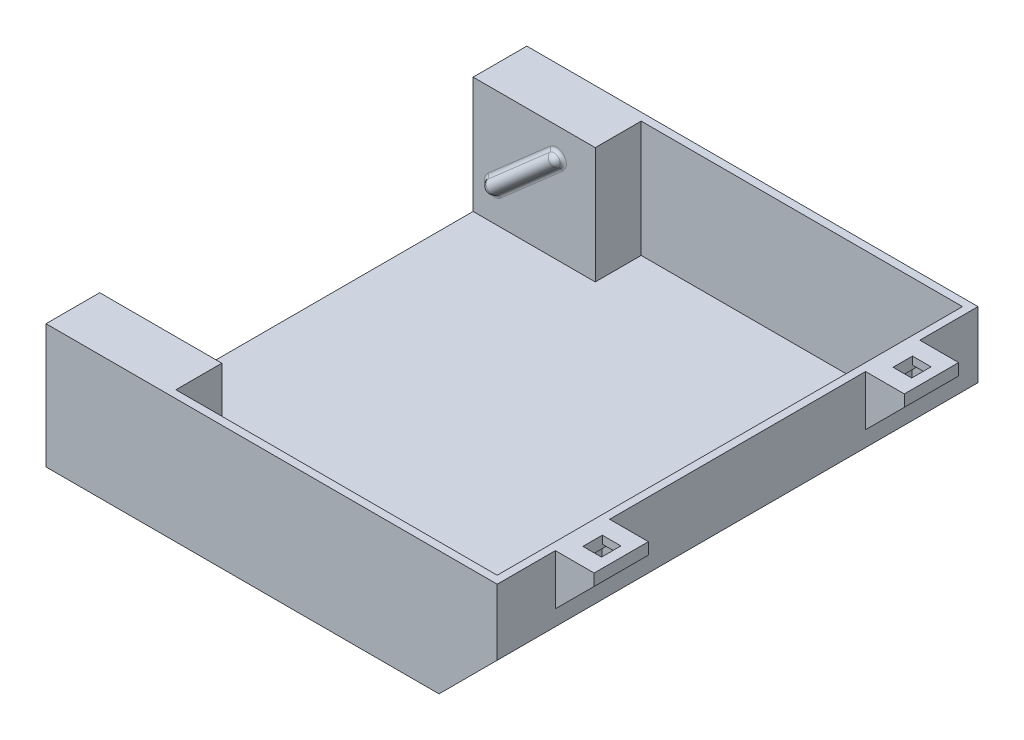
from build123d import *

# Parameters (mm, degrees)
BOSS_EXTRUDE1_DEPTH  = 30
SKETCH3_W            = 116.36
SKETCH3_H            = 124
BOSS_EXTRUDE2_DEPTH  = 2
REVOLVE1_ANGLE       = 358
FILLET1_R            = 1
CUT_EXTRUDE1_REACH   = 187.043
BOSS_EXTRUDE3_REACH  = 185.709
SKETCH9_R            = 2
SKETCH9_R_2          = 4
CUT_EXTRUDE3_DEPTH   = 1
SKETCH10_W           = 10
SKETCH10_H           = 10
SKETCH10_R           = 2.4
BOSS_EXTRUDE4_DEPTH  = 3
BOSS_EXTRUDE5_DEPTH  = 2
CUT_EXTRUDE4_DEPTH   = 1
SKETCH13_W           = 4.8
SKETCH13_H           = 5
CUT_EXTRUDE5_DEPTH   = 2
MIRROR4_COPY_1_DEPTH = 2
CUT_EXTRUDE6_START   = -0.5
CUT_EXTRUDE6_DEPTH   = 0.5


# Read off the part's stored shape, not the designer's step: Cut-Extrude6
with BuildPart() as part:
    # Sketch2 → Boss-Extrude1 (new body)
    with BuildSketch(Plane.XZ.offset(30)):
        Polygon((-102.07, -96.15), (-133.57, -96.15), (-133.57, -110), (-17.21, -110), (-17.21, 14), (-133.57, 14), (-133.57, 0.15), (-102.07, 0.15), (-102.07, 12), (-19.21, 12), (-19.21, 0.15), (-19.21, -96.15), (-19.21, -108), (-102.07, -108), align=None)
    extrude(amount=-BOSS_EXTRUDE1_DEPTH)

    # Sketch3 → Boss-Extrude2 (add)
    with BuildSketch(Plane.XZ.offset(30)):
        with Locations((-75.39, -48)):
            Rectangle(SKETCH3_W, SKETCH3_H)
    extrude(amount=BOSS_EXTRUDE2_DEPTH)

    # Sketch4 → Revolve1 (revolve)
    with BuildSketch(Plane(origin=(0, 0, 0.15), x_dir=(-1, 0, 0), z_dir=(0, 0, -1))):
        with BuildLine():
            ThreePointArc((126.946389188, -22.830754007), (128.214647144, -23.261442668), (129.415983818, -22.669191741))
            Line((129.415983818, -22.669191741), (110.772864663, -6.315578448))
            ThreePointArc((110.772864663, -6.315578448), (110.342176002, -7.583836403), (110.934426929, -8.785173077))
            Line((110.934426929, -8.785173077), (126.946389188, -22.830754007))
        make_face()
    revolve1 = revolve(axis=Axis((-128.10040537, -21.515175559, 0.15), (0.7517591128712743, 0.6594378183081363, 0)), revolution_arc=REVOLVE1_ANGLE)

    # Mirror3: Revolve1 across plane
    add(revolve1.mirror(Plane(origin=(0, 0, -48), x_dir=(1, 0, 0), z_dir=(0, 0, -1))))

    # Fillet1
    fillet1_edges = [part.edges().sort_by_distance(p)[0] for p in [
        (-128.214647144, -23.261442668, 0.15),
        (-121.248440423, -13.176806647, 0.15),
        (-111.974201337, -5.72332752, 0.15),
        (-118.940408059, -15.807963542, 0.15),
        (-128.214647144, -23.261442668, -96.15),
        (-121.248440423, -13.176806647, -96.15),
        (-111.974201337, -5.72332752, -96.15),
        (-118.940408059, -15.807963542, -96.15),
    ]]
    fillet(fillet1_edges, radius=FILLET1_R)

    # Cut-Extrude1: up to this face of the body (flat: up to its plane)
    cut_extrude1_end = Plane(part.part.faces().sort_by_distance((-75.39, -16, 14))[0])
    # Sketch5 → Cut-Extrude1 (cut, up to the picked face)
    with BuildSketch(Plane(origin=(0, 0, -110), x_dir=(-1, 0, 0), z_dir=(0, 0, -1)), mode=Mode.PRIVATE) as cut_extrude1_sk1:
        Polygon((32.21, -32), (17.21, -17), (17.21, -32), align=None)
    cut_extrude1_tool1 = split(extrude(cut_extrude1_sk1.sketch, amount=-CUT_EXTRUDE1_REACH, mode=Mode.PRIVATE), bisect_by=cut_extrude1_end, keep=Keep.BOTH, mode=Mode.PRIVATE)
    add(cut_extrude1_tool1.solids().sort_by(Axis((-22.21, -27, -110), (0, 0, 1)))[0], mode=Mode.SUBTRACT)

    # Sketch7 → Boss-Extrude3 (add, up to next)
    with BuildSketch(Plane(origin=(0, 0, 12), x_dir=(-1, 0, 0), z_dir=(0, 0, -1)), mode=Mode.PRIVATE) as boss_extrude3_sk1:
        Polygon((33.038427125, -30), (19.21, -16.171572875), (19.21, -19), (30.21, -30), align=None)
    boss_extrude3_tool1 = extrude(boss_extrude3_sk1.sketch, amount=BOSS_EXTRUDE3_REACH, mode=Mode.PRIVATE) - part.part
    add(boss_extrude3_tool1.solids().sort_by_distance((-25.443958, -23.766042, 12))[0])

    # Sketch9 → Cut-Extrude3 (cut)
    with BuildSketch(Plane(origin=(0, 0, -110), x_dir=(-1, 0, 0), z_dir=(0, 0, -1))):
        with Locations((111.05096655, -7)):
            Circle(SKETCH9_R)
        with Locations((111.05096655, -23)):
            Circle(SKETCH9_R_2)
        with Locations((111.05096655, -13)):
            Circle(SKETCH9_R)
        Polygon((127.147055737, -27), (121.090407141, -27), (122.676520454, -19.790973413), (116.946384418, -19.790973413), (122.811770426, -5), (122.811770426, -15.583196494), (127.147055737, -15.583196494), align=None)
        Polygon((113.010558344, -12.6), (114.970150138, -22.2), (107.131782961, -22.2), (109.091374756, -12.6), align=None)
    extrude(amount=-CUT_EXTRUDE3_DEPTH, mode=Mode.SUBTRACT)

    # Sketch10 → Boss-Extrude4 (add)
    with BuildSketch(Plane.XZ):
        with Locations((-12.21, -88)):
            Rectangle(SKETCH10_W, SKETCH10_H)
        with Locations((-12.21, -88)):
            Circle(SKETCH10_R, mode=Mode.SUBTRACT)
    boss_extrude4 = extrude(amount=BOSS_EXTRUDE4_DEPTH)

    # Sketch11 → Boss-Extrude5 (add)
    with BuildSketch(Plane(origin=(0, 0, -93), x_dir=(-1, 0, 0), z_dir=(0, 0, -1))):
        Polygon((7.21, -3), (17.21, -13), (17.21, 0), (7.21, 0), align=None)
    boss_extrude5 = extrude(amount=BOSS_EXTRUDE5_DEPTH)

    # Mirror5: Boss-Extrude5 across plane
    add(boss_extrude5.mirror(Plane.XY.offset(-88)))

    # Sketch12 → Cut-Extrude4 (cut)
    with BuildSketch(Plane.XZ.offset(3)):
        Polygon((-9.81, -88), (-9.81, -93), (-14.61, -93), (-14.61, -88), (-14.61, -83), (-9.81, -83), align=None)
    cut_extrude4 = extrude(amount=-CUT_EXTRUDE4_DEPTH, mode=Mode.SUBTRACT)

    # Sketch13 → Cut-Extrude5 (cut)
    with BuildSketch(Plane.XZ.offset(2)):
        with Locations((-12.21, -88)):
            Rectangle(SKETCH13_W, SKETCH13_H)
    cut_extrude5 = extrude(amount=-CUT_EXTRUDE5_DEPTH, mode=Mode.SUBTRACT)

    # Mirror4: Boss-Extrude4, Boss-Extrude5, Cut-Extrude4, Cut-Extrude5 across plane
    add(boss_extrude4.mirror(Plane.XY.offset(-48)))
    add(boss_extrude5.mirror(Plane.XY.offset(-48)))
    add(cut_extrude4.mirror(Plane.XY.offset(-48)), mode=Mode.SUBTRACT)
    add(cut_extrude5.mirror(Plane.XY.offset(-48)), mode=Mode.SUBTRACT)

    # Mirror4 copy 1 sketch → Mirror4 copy 1 (add)
    with BuildSketch(Plane(origin=(0, 0, -13), x_dir=(-1, 0, 0), z_dir=(0, 0, -1))):
        Polygon((7.21, -3), (17.21, -13), (17.21, 0), (7.21, 0), align=None)
    extrude(amount=MIRROR4_COPY_1_DEPTH)

    # Cut-Extrude6 outline → Cut-Extrude6 (cut)
    # profile 1 of 9: a face of its own
    with BuildSketch(Plane(origin=(-0.105, 0.105, 0), x_dir=(0, 0, -1), z_dir=(0.7071067811865476, -0.7071067811865476, 0)).offset(CUT_EXTRUDE6_START)):
        with BuildLine():
            add(Edge.make_bspline(
                [(7.474736048, -32.560187678), (7.481784989, -32.686737386), (7.495462968, -32.932298263), (7.554582597, -33.28662707), (7.642912572, -33.615333656), (7.761441798, -33.919784296), (7.913473714, -34.198728864), (8.095232248, -34.453133811), (8.308026903, -34.682350235), (8.553290569, -34.87969149), (8.816458503, -35.056906889), (9.09589014, -35.209228141), (9.388017477, -35.338190216), (9.692140765, -35.443177021), (10.008629383, -35.528095419), (10.338990287, -35.582377682), (10.681600511, -35.617811607), (10.914185968, -35.621856709), (11.032428356, -35.623913168)],
                knots=[0, 0, 0, 0, 0.071932954, 0.139580877, 0.203559558, 0.26492787, 0.324655415, 0.383483764, 0.44206478, 0.501651417, 0.561832516, 0.622044295, 0.682123722, 0.742958404, 0.804591799, 0.867957378, 0.932871835, 1, 1, 1, 1], degree=3))
            add(Edge.make_bspline(
                [(11.032428356, -35.623913168), (11.135629491, -35.62275178), (11.334964247, -35.62050854), (11.532796246, -35.596094582), (11.628205128, -35.584320408)],
                knots=[0, 0, 0, 0, 0.517727753, 1, 1, 1, 1], degree=3))
            Line((11.628205128, -35.584320408), (11.344989115, -37.580923061))
            Line((11.344989115, -37.580923061), (7.763667088, -37.580923061))
            Line((7.763667088, -37.580923061), (7.763667088, -39.134469396))
            Line((7.763667088, -39.134469396), (12.836290639, -39.134469396))
            Line((12.836290639, -39.134469396), (13.489622735, -34.149962936))
            add(Edge.make_bspline(
                [(13.489622735, -34.149962936), (13.400894652, -34.160062564), (13.215783257, -34.181133189), (12.924845872, -34.1975649), (12.610633708, -34.212455799), (12.393059012, -34.213247395), (12.280542986, -34.213656758)],
                knots=[0, 0, 0, 0, 0.221099217, 0.461274306, 0.721404763, 1, 1, 1, 1], degree=3))
            add(Edge.make_bspline(
                [(12.280542986, -34.213656758), (12.170527336, -34.212261595), (11.956535838, -34.209547862), (11.646156106, -34.187153046), (11.356173038, -34.148927873), (11.086718503, -34.099865663), (10.83824514, -34.032746726), (10.609618542, -33.955393141), (10.402088982, -33.860077802), (10.215256552, -33.751512139), (10.04967142, -33.628638903), (9.906689566, -33.491623503), (9.78559612, -33.341800701), (9.683999886, -33.180452089), (9.606098096, -33.005173519), (9.552204193, -32.816623148), (9.516946586, -32.616173424), (9.512966995, -32.478013034), (9.510935143, -32.407472746)],
                knots=[0, 0, 0, 0, 0.088558352, 0.172254896, 0.250318508, 0.323942698, 0.392542315, 0.457340998, 0.518010803, 0.576058968, 0.631001494, 0.683599686, 0.735036649, 0.785714141, 0.836671168, 0.888861455, 0.943256205, 1, 1, 1, 1], degree=3))
            add(Edge.make_bspline(
                [(9.510935143, -32.407472746), (9.515313327, -32.340092176), (9.523874534, -32.208334555), (9.558047701, -32.016719441), (9.610321639, -31.836800364), (9.682516846, -31.669929411), (9.772512083, -31.515015463), (9.879778981, -31.371118342), (10.007202979, -31.240773572), (10.150886344, -31.124215465), (10.307123124, -31.021657413), (10.471551796, -30.930643014), (10.643782582, -30.853355552), (10.823141424, -30.788590103), (11.010783213, -30.740048619), (11.204865407, -30.704661214), (11.40639609, -30.680655659), (11.543292456, -30.678038504), (11.613122172, -30.676703515)],
                knots=[0, 0, 0, 0, 0.066600926, 0.130233086, 0.191662727, 0.251116047, 0.309201236, 0.368124829, 0.427778404, 0.488613353, 0.550370905, 0.612000623, 0.673907498, 0.73649114, 0.799978035, 0.864941462, 0.931107746, 1, 1, 1, 1], degree=3))
            add(Edge.make_bspline(
                [(11.613122172, -30.676703515), (11.716250548, -30.679987282), (11.918464833, -30.686426096), (12.216308989, -30.714959959), (12.502146395, -30.759798276), (12.774192762, -30.82058749), (13.027431068, -30.889568027), (13.257854782, -30.962621869), (13.462038342, -31.038968646), (13.586770856, -31.096448809), (13.645550528, -31.123536094)],
                knots=[0, 0, 0, 0, 0.147651019, 0.289514355, 0.427930962, 0.561495696, 0.688273037, 0.803481788, 0.90739162, 1, 1, 1, 1], degree=3))
            Line((13.645550528, -31.123536094), (14.057737601, -29.660489337))
            add(Edge.make_bspline(
                [(14.057737601, -29.660489337), (13.984891363, -29.626741054), (13.830649427, -29.555283685), (13.576268882, -29.464667197), (13.290055088, -29.37828999), (12.973798652, -29.299667146), (12.632191287, -29.234035082), (12.270330255, -29.185219838), (11.890758767, -29.155140273), (11.632029264, -29.148944929), (11.5, -29.145783455)],
                knots=[0, 0, 0, 0, 0.091590522, 0.19393039, 0.307840036, 0.432747493, 0.56568423, 0.704658722, 0.849287804, 1, 1, 1, 1], degree=3))
            add(Edge.make_bspline(
                [(11.5, -29.145783455), (11.345844829, -29.15153033), (11.046031649, -29.162707307), (10.610143875, -29.219325541), (10.200327509, -29.300016773), (9.817038045, -29.414266075), (9.459404205, -29.555150988), (9.127064531, -29.72510467), (8.821461518, -29.925841576), (8.545394197, -30.15574495), (8.299356658, -30.407008708), (8.080187776, -30.670738731), (7.896442293, -30.95107944), (7.746831944, -31.24622055), (7.626736478, -31.553967937), (7.542500434, -31.877339731), (7.488232083, -32.214004345), (7.479276688, -32.443716899), (7.474736048, -32.560187678)],
                knots=[0, 0, 0, 0, 0.078431806, 0.152540384, 0.223322642, 0.290686454, 0.355689299, 0.418598088, 0.480220108, 0.54128905, 0.600967427, 0.658886016, 0.715454944, 0.771070096, 0.826934595, 0.883151957, 0.940754729, 1, 1, 1, 1], degree=3))
        make_face()
    # profile 2 of 9: a face of its own
    with BuildSketch(Plane(origin=(-0.105, 0.105, 0), x_dir=(0, 0, -1), z_dir=(0.7071067811865476, -0.7071067811865476, 0)).offset(CUT_EXTRUDE6_START)):
        with BuildLine():
            add(Edge.make_bspline(
                [(17.325414781, -31.642012716), (17.413829101, -31.636329218), (17.584419352, -31.625363241), (17.827769919, -31.558201975), (18.044701278, -31.447215565), (18.232046001, -31.295100607), (18.386307437, -31.109674091), (18.498440558, -30.894274392), (18.571205655, -30.653587783), (18.581435261, -30.483677443), (18.586726998, -30.395783455)],
                knots=[0, 0, 0, 0, 0.134054034, 0.258649407, 0.379667062, 0.50093949, 0.622077105, 0.742689012, 0.866893981, 1, 1, 1, 1], degree=3))
            add(Edge.make_bspline(
                [(18.586726998, -30.395783455), (18.581987108, -30.306671883), (18.572869761, -30.135262616), (18.503828305, -29.892592523), (18.398241486, -29.674188592), (18.247214563, -29.487488142), (18.063255594, -29.332187317), (17.844633555, -29.218874018), (17.594873712, -29.150596367), (17.418175706, -29.140002166), (17.32626261, -29.134521789)],
                knots=[0, 0, 0, 0, 0.133513631, 0.256818201, 0.375732821, 0.495158488, 0.614315849, 0.734513257, 0.861704257, 0.999576079, 0.999576079, 0.999576079, 0.999576079], degree=3))
            add(Edge.make_bspline(
                [(17.32626261, -29.134521789), (17.234425797, -29.139347744), (17.057929662, -29.148691624), (16.808675223, -29.215362376), (16.589607409, -29.324951497), (16.404422539, -29.474654689), (16.2543648, -29.657951113), (16.148073287, -29.872714574), (16.080164102, -30.113979401), (16.070826091, -30.284704104), (16.065987934, -30.37315902)],
                knots=[0.000501848, 0.000501848, 0.000501848, 0.000501848, 0.139177534, 0.267028384, 0.387218501, 0.506757808, 0.624223306, 0.742289949, 0.866476729, 1, 1, 1, 1], degree=3))
            add(Edge.make_bspline(
                [(16.065987934, -30.37315902), (16.071339616, -30.466030537), (16.081580076, -30.643740451), (16.151606608, -30.894645464), (16.261076326, -31.115928587), (16.414608427, -31.303124792), (16.602617706, -31.45281703), (16.819951383, -31.562445967), (17.064771384, -31.62710806), (17.23641214, -31.636923181), (17.325414781, -31.642012716)],
                knots=[0, 0, 0, 0, 0.138763142, 0.26552367, 0.386557335, 0.50543776, 0.624459236, 0.743391647, 0.866938239, 1, 1, 1, 1], degree=3))
        make_face()
    # profile 3 of 9: a face of its own
    with BuildSketch(Plane(origin=(-0.105, 0.105, 0), x_dir=(0, 0, -1), z_dir=(0.7071067811865476, -0.7071067811865476, 0)).offset(CUT_EXTRUDE6_START)):
        with BuildLine():
            add(Edge.make_bspline(
                [(24.990950226, -37.703475763), (24.920487201, -37.700733487), (24.783556023, -37.695404407), (24.586266218, -37.670783868), (24.402867201, -37.633956371), (24.235552741, -37.580351174), (24.080659318, -37.517541578), (23.942303354, -37.436780405), (23.816821684, -37.345414774), (23.708734859, -37.2378875), (23.615399619, -37.121164759), (23.533654948, -36.998258961), (23.464900395, -36.86812815), (23.408649445, -36.731143737), (23.365165226, -36.58717967), (23.33483741, -36.436971036), (23.318048809, -36.279783766), (23.315935471, -36.172594857), (23.314856712, -36.117879986)],
                knots=[0, 0, 0, 0, 0.080836785, 0.157090562, 0.227765582, 0.295009514, 0.358322524, 0.419021825, 0.478266002, 0.535856279, 0.593261355, 0.649431573, 0.70488515, 0.761767545, 0.818995899, 0.877089079, 0.937259784, 1, 1, 1, 1], degree=3))
            add(Edge.make_bspline(
                [(23.314856712, -36.117879986), (23.317829231, -36.035338964), (23.323836436, -35.868530707), (23.371194856, -35.619196266), (23.436057693, -35.365441297), (23.531681623, -35.110651798), (23.650915544, -34.851603509), (23.799626653, -34.593191255), (23.969298649, -34.328540841), (24.169731862, -34.064027501), (24.391281869, -33.789999776), (24.63412328, -33.505959086), (24.899566672, -33.211827739), (25.183715078, -32.903967068), (25.49147498, -32.585644224), (25.82088975, -32.256345772), (26.172765374, -31.916227876), (26.416008706, -31.687593613), (26.540723982, -31.570368674)],
                knots=[0, 0, 0, 0, 0.043348568, 0.087603702, 0.133027855, 0.180886833, 0.230391752, 0.282748674, 0.337442309, 0.395507591, 0.457046171, 0.522641756, 0.59187352, 0.6652618, 0.74281311, 0.824555661, 0.9100465, 1, 1, 1, 1], degree=3))
            Line((26.540723982, -31.570368674), (27.733833324, -30.404510654))
            Line((27.733833324, -30.404510654), (27.733833324, -29.255134888))
            Line((27.733833324, -29.255134888), (21.08169726, -29.255134888))
            Line((21.08169726, -29.255134888), (21.08169726, -30.808679382))
            Line((21.08169726, -30.808679382), (24.964273352, -30.808679382))
            Line((24.964273352, -30.808679382), (24.964273352, -30.83489412))
            Line((24.964273352, -30.83489412), (24.069492438, -31.647550989))
            add(Edge.make_bspline(
                [(24.069492438, -31.647550989), (23.878224764, -31.827237786), (23.503849898, -32.178945), (22.985119031, -32.7305918), (22.516684291, -33.287912323), (22.160214399, -33.759079478), (21.910265886, -34.142885683), (21.748812575, -34.435173325), (21.611718524, -34.732908474), (21.49543149, -35.035375189), (21.404568834, -35.343681461), (21.339189242, -35.657780262), (21.294428204, -35.977185523), (21.283932777, -36.19252697), (21.278657617, -36.30076083)],
                knots=[0, 0, 0, 0, 0.141044372, 0.276071053, 0.406742324, 0.532278129, 0.593374672, 0.652797979, 0.71159574, 0.769442499, 0.826845633, 0.884157239, 0.94177568, 1, 1, 1, 1], degree=3))
            add(Edge.make_bspline(
                [(21.278657617, -36.30076083), (21.280671289, -36.402042019), (21.284636746, -36.601491632), (21.320708956, -36.89455051), (21.383054065, -37.174766906), (21.470455265, -37.442354119), (21.581362312, -37.69824925), (21.720075878, -37.94037796), (21.883777633, -38.169566692), (22.069652178, -38.386885246), (22.282634443, -38.58727901), (22.52858619, -38.757936477), (22.79982787, -38.906660225), (23.09986043, -39.026051509), (23.426721475, -39.122774805), (23.781483585, -39.192637089), (24.163900006, -39.241107835), (24.428327109, -39.250358542), (24.564856712, -39.255134888)],
                knots=[0, 0, 0, 0, 0.060806115, 0.119743423, 0.176972643, 0.232948626, 0.288553122, 0.344166583, 0.400193438, 0.457463712, 0.515681236, 0.575262739, 0.636739813, 0.701077851, 0.768786907, 0.841175994, 0.917995628, 1, 1, 1, 1], degree=3))
            add(Edge.make_bspline(
                [(24.564856712, -39.255134888), (24.717740298, -39.250672171), (25.01874365, -39.241885794), (25.458981488, -39.187002252), (25.881177531, -39.107395831), (26.279656833, -38.994437131), (26.650765064, -38.857581298), (26.993188394, -38.712899664), (27.300443002, -38.551251516), (27.486199093, -38.428308395), (27.575791855, -38.369011207)],
                knots=[0, 0, 0, 0, 0.14407048, 0.283651753, 0.417580824, 0.548645251, 0.673428707, 0.790161205, 0.898791813, 1, 1, 1, 1], degree=3))
            Line((27.575791855, -38.369011207), (26.995283999, -36.98225011))
            add(Edge.make_bspline(
                [(26.995283999, -36.98225011), (26.929676395, -37.026631906), (26.79522823, -37.117582508), (26.579796707, -37.244332673), (26.345604364, -37.361173771), (26.099252725, -37.475718858), (25.837772924, -37.572560335), (25.564404288, -37.643670553), (25.280962926, -37.690678398), (25.088543033, -37.699169293), (24.990950226, -37.703475763)],
                knots=[0, 0, 0, 0, 0.10991459, 0.225245463, 0.346555609, 0.473020633, 0.602158273, 0.732897114, 0.864528974, 1, 1, 1, 1], degree=3))
        make_face()
    # profile 4 of 9: a face of its own
    with BuildSketch(Plane(origin=(-0.105, 0.105, 0), x_dir=(0, 0, -1), z_dir=(0.7071067811865476, -0.7071067811865476, 0)).offset(CUT_EXTRUDE6_START)):
        with BuildLine():
            Line((46.144217513, -39.255133047), (48.487691336, -35.874302762))
            add(Edge.make_bspline(
                [(48.487691336, -35.874302762), (48.603369845, -35.685388383), (48.836400114, -35.304827041), (49.066835728, -34.922688988), (49.182880845, -34.73024801)],
                knots=[0, 0, 0, 0, 0.496409799, 1, 1, 1, 1], degree=3))
            Line((49.182880845, -34.73024801), (49.226240662, -34.729927644))
            Line((49.226240662, -34.729927644), (49.226240662, -39.255133047))
            Line((49.226240662, -39.255133047), (51.262443439, -39.255133047))
            Line((51.262443439, -39.255133047), (51.262443439, -29.255133047))
            Line((51.262443439, -29.255133047), (49.226240662, -29.255133047))
            Line((49.226240662, -29.255133047), (49.226240662, -32.675254137))
            Line((49.226240662, -32.675254137), (48.416676977, -33.676582365))
            Line((48.416676977, -33.676582365), (45.888565823, -29.255133047))
            Line((45.888565823, -29.255133047), (43.488280514, -29.255133047))
            Line((43.488280514, -29.255133047), (46.939578325, -34.977008636))
            Line((46.939578325, -34.977008636), (43.644512102, -39.255133047))
            Line((43.644512102, -39.255133047), (46.144217513, -39.255133047))
        make_face()
    # profile 5 of 9: a face of its own
    with BuildSketch(Plane(origin=(-0.105, 0.105, 0), x_dir=(0, 0, -1), z_dir=(0.7071067811865476, -0.7071067811865476, 0)).offset(CUT_EXTRUDE6_START)):
        with BuildLine():
            add(Edge.make_bspline(
                [(82.578808446, -38.738543636), (82.672007013, -38.795184967), (82.861417719, -38.910299127), (83.170291127, -39.0486174), (83.502023907, -39.159818239), (83.858168478, -39.244249801), (84.240873852, -39.305308192), (84.653817945, -39.347453185), (85.097910224, -39.375122322), (85.404933074, -39.375568383), (85.563348416, -39.375798538)],
                knots=[0, 0, 0, 0, 0.105621395, 0.214658056, 0.327146471, 0.444300722, 0.56897106, 0.702493007, 0.846494578, 1, 1, 1, 1], degree=3))
            add(Edge.make_bspline(
                [(85.563348416, -39.375798538), (85.824836179, -39.372820172), (86.333731392, -39.367023817), (86.95743495, -39.331341789), (87.42377458, -39.286650144), (87.738393985, -39.254379544), (88.021356873, -39.215170947), (88.19855326, -39.183385667), (88.282051282, -39.168407889)],
                knots=[0, 0, 0, 0, 0.287357548, 0.559241776, 0.686172265, 0.802176441, 0.906782095, 1, 1, 1, 1], degree=3))
            Line((88.282051282, -39.168407889), (88.282051282, -29.26355645))
            add(Edge.make_bspline(
                [(88.282051282, -29.26355645), (88.215460788, -29.254886448), (88.07426793, -29.236503306), (87.849973682, -29.211790353), (87.601002601, -29.191347718), (87.327503335, -29.17520837), (87.02965212, -29.159429845), (86.706541529, -29.149147754), (86.359025786, -29.138946657), (86.118911611, -29.135993841), (85.995098039, -29.134471238)],
                knots=[0, 0, 0, 0, 0.087893802, 0.186362593, 0.295318855, 0.414821763, 0.544955105, 0.685701991, 0.837933936, 1, 1, 1, 1], degree=3))
            add(Edge.make_bspline(
                [(85.995098039, -29.134471238), (85.873168667, -29.135163139), (85.634911485, -29.136515154), (85.286013279, -29.147977656), (84.953459675, -29.166711399), (84.637154807, -29.192538488), (84.337443827, -29.227233122), (84.054010802, -29.265022248), (83.787814983, -29.315440507), (83.536564749, -29.369172914), (83.300496628, -29.431059665), (83.079000921, -29.501977377), (82.869952262, -29.575902382), (82.674833055, -29.65921045), (82.493957839, -29.750026186), (82.325462188, -29.845306156), (82.171247358, -29.949727898), (82.07678872, -30.026208963), (82.030165913, -30.063958417)],
                knots=[0, 0, 0, 0, 0.088179237, 0.172307428, 0.252429853, 0.329051868, 0.401780249, 0.470621333, 0.535787383, 0.597657258, 0.656417251, 0.712190401, 0.765816567, 0.816723492, 0.865506409, 0.912128385, 0.956628409, 1, 1, 1, 1], degree=3))
            add(Edge.make_bspline(
                [(82.030165913, -30.063958417), (81.954438226, -30.130845889), (81.804872852, -30.262951467), (81.609446455, -30.487874426), (81.443665479, -30.7304807), (81.303186171, -30.986944688), (81.193534727, -31.256472599), (81.117568561, -31.535231571), (81.065000234, -31.820427508), (81.058640837, -32.013821609), (81.055429864, -32.111469729)],
                knots=[0, 0, 0, 0, 0.12935453, 0.255480651, 0.380561371, 0.505237079, 0.629498629, 0.752388038, 0.874976318, 1, 1, 1, 1], degree=3))
            add(Edge.make_bspline(
                [(81.055429864, -32.111469729), (81.058308369, -32.190160334), (81.063950702, -32.344406579), (81.098048938, -32.569130091), (81.143640352, -32.784224495), (81.210856804, -32.988232057), (81.292713479, -33.183666022), (81.396524092, -33.366439759), (81.512533138, -33.541830442), (81.649409407, -33.702782628), (81.798492135, -33.853641732), (81.958645958, -33.993696975), (82.1306467, -34.119696288), (82.3124453, -34.233733144), (82.505006143, -34.333428024), (82.708198038, -34.420048424), (82.921241846, -34.496657435), (83.069292709, -34.535299965), (83.144419306, -34.554908643)],
                knots=[0, 0, 0, 0, 0.067786574, 0.132872589, 0.195535261, 0.257005284, 0.317649459, 0.377759528, 0.437828128, 0.498556841, 0.559432613, 0.620452685, 0.681638284, 0.742933984, 0.805171819, 0.868233227, 0.933136565, 1, 1, 1, 1], degree=3))
            Line((83.144419306, -34.554908643), (83.14459606, -34.605863333))
            add(Edge.make_bspline(
                [(83.14459606, -34.605863333), (83.081383603, -34.633457039), (82.956595139, -34.687930104), (82.777936376, -34.779787711), (82.611417233, -34.880461813), (82.454982433, -34.987557057), (82.312595373, -35.107076038), (82.179897935, -35.232731462), (82.060366414, -35.368438196), (81.916225714, -35.556383689), (81.767331033, -35.808723966), (81.635107818, -36.129475758), (81.55552073, -36.468524102), (81.543948058, -36.700045684), (81.538084465, -36.817352082)],
                knots=[0, 0, 0, 0, 0.071150577, 0.140459203, 0.207067473, 0.271819458, 0.335826993, 0.398654504, 0.460200893, 0.5221897, 0.642841851, 0.761202057, 0.879006845, 1, 1, 1, 1], degree=3))
            add(Edge.make_bspline(
                [(81.538084465, -36.817352082), (81.541537606, -36.920708674), (81.548284207, -37.122642385), (81.606017161, -37.415378948), (81.690792349, -37.690766311), (81.813913572, -37.945107361), (81.963863226, -38.179549055), (82.144185522, -38.389444311), (82.345456175, -38.582220861), (82.500433579, -38.686040283), (82.578808446, -38.738543636)],
                knots=[0, 0, 0, 0, 0.135682219, 0.265090147, 0.390711737, 0.513341876, 0.635202187, 0.755318023, 0.876259913, 1, 1, 1, 1], degree=3))
        make_face()
        with BuildLine():
            Line((86.245848505, -35.141256727), (86.245848505, -37.876007328))
            add(Edge.make_bspline(
                [(86.245848505, -37.876007328), (86.193823937, -37.886621779), (86.074294767, -37.911009038), (85.867842758, -37.928737617), (85.611860731, -37.938976891), (85.424477835, -37.941524641), (85.322021116, -37.942917693)],
                knots=[0, 0, 0, 0, 0.171556976, 0.394161141, 0.668741048, 1, 1, 1, 1], degree=3))
            add(Edge.make_bspline(
                [(85.322021116, -37.942917693), (85.205566001, -37.940780271), (84.981378019, -37.936665515), (84.657259556, -37.883759228), (84.362243146, -37.789110067), (84.136772888, -37.680012916), (83.977667426, -37.568675111), (83.873488165, -37.470738568), (83.785739772, -37.356850134), (83.712058976, -37.231046274), (83.655089001, -37.089801255), (83.612301114, -36.93552999), (83.583708916, -36.766791403), (83.577492007, -36.649667927), (83.57428356, -36.589222369)],
                knots=[0, 0, 0, 0, 0.139073938, 0.267731525, 0.390766118, 0.508323901, 0.565423395, 0.622270422, 0.678458735, 0.73668321, 0.795959022, 0.85992178, 0.927707864, 1, 1, 1, 1], degree=3))
            add(Edge.make_bspline(
                [(83.57428356, -36.589222369), (83.576398095, -36.536986221), (83.580573734, -36.433833861), (83.604483461, -36.282862598), (83.647491332, -36.140740517), (83.701167269, -36.004845572), (83.774507073, -35.879068018), (83.858611342, -35.758231401), (83.963013147, -35.64920581), (84.078454768, -35.545400343), (84.209643802, -35.452877323), (84.35375391, -35.371714473), (84.510176784, -35.301882082), (84.679645415, -35.24571149), (84.860998353, -35.199971812), (85.056015601, -35.169059215), (85.263137506, -35.147943137), (85.405552713, -35.143522895), (85.478506787, -35.141258568)],
                knots=[0, 0, 0, 0, 0.058458899, 0.115440621, 0.17039104, 0.224310862, 0.278463936, 0.332894685, 0.388608868, 0.446877215, 0.506375316, 0.56776648, 0.631655081, 0.697685622, 0.767255564, 0.840649359, 0.918370526, 1, 1, 1, 1], degree=3))
            Line((85.478506787, -35.141258568), (86.245848505, -35.141256727))
        make_face(mode=Mode.SUBTRACT)
        with BuildLine():
            Line((86.245848505, -33.731000317), (85.464791829, -33.731000317))
            add(Edge.make_bspline(
                [(85.464791829, -33.731000317), (85.320746983, -33.729228357), (85.040867008, -33.72578543), (84.636139522, -33.656357229), (84.257951851, -33.548497989), (83.966615688, -33.416745338), (83.754932265, -33.287435454), (83.616951706, -33.17267036), (83.499481391, -33.041421726), (83.400757478, -32.895708175), (83.322555902, -32.734341631), (83.263927615, -32.557645526), (83.226691431, -32.364886437), (83.217174209, -32.231031804), (83.212292609, -32.162374707)],
                knots=[0, 0, 0, 0, 0.139950818, 0.271925253, 0.398069207, 0.521735166, 0.581617957, 0.638920115, 0.695635418, 0.752442919, 0.80959157, 0.869527398, 0.933077624, 1, 1, 1, 1], degree=3))
            add(Edge.make_bspline(
                [(83.212292609, -32.162374707), (83.215617062, -32.094932444), (83.222095261, -31.963510994), (83.259997667, -31.774336315), (83.310686829, -31.598120041), (83.384285665, -31.438039936), (83.47280954, -31.290255752), (83.58322826, -31.158650119), (83.710555654, -31.039870272), (83.856839644, -30.939410339), (84.015764431, -30.850812279), (84.184738287, -30.774889749), (84.361630233, -30.707132134), (84.547951263, -30.65508158), (84.744183484, -30.616142968), (84.947906977, -30.585595368), (85.161455439, -30.568151884), (85.306278363, -30.567623011), (85.380467572, -30.567352082)],
                knots=[0, 0, 0, 0, 0.066731024, 0.130035493, 0.190438485, 0.247776546, 0.303880358, 0.360416829, 0.417188833, 0.475678945, 0.535541637, 0.597048725, 0.658847533, 0.72283265, 0.788208097, 0.856723657, 0.926603067, 1, 1, 1, 1], degree=3))
            add(Edge.make_bspline(
                [(85.380467572, -30.567352082), (85.467837248, -30.567329774), (85.631953488, -30.56728787), (85.86334883, -30.576950127), (86.064329556, -30.591901742), (86.18749189, -30.611264033), (86.243966817, -30.620142429)],
                knots=[0, 0, 0, 0, 0.302564613, 0.568340975, 0.802066825, 1, 1, 1, 1], degree=3))
            Line((86.243966817, -30.620142429), (86.245848505, -33.731000317))
        make_face(mode=Mode.SUBTRACT)
    # profile 6 of 9: a face of its own
    with BuildSketch(Plane(origin=(-0.105, 0.105, 0), x_dir=(0, 0, -1), z_dir=(0.7071067811865476, -0.7071067811865476, 0)).offset(CUT_EXTRUDE6_START)):
        Polygon((53.812282741, -29.255134888), (53.812282741, -30.808679382), (57.817492547, -30.808679382), (57.817492547, -33.719688099), (54.252571762, -33.719688099), (54.252571762, -35.273232594), (57.817492547, -35.273232594), (57.817492547, -37.701586711), (54.039528687, -37.701586711), (54.039528687, -39.255133047), (59.853695324, -39.255133047), (59.853695324, -29.255134888), align=None)
    # profile 7 of 9: a face of its own
    with BuildSketch(Plane(origin=(-0.105, 0.105, 0), x_dir=(0, 0, -1), z_dir=(0.7071067811865476, -0.7071067811865476, 0)).offset(CUT_EXTRUDE6_START)):
        Polygon((36.499329442, -31.909733348), (35.718171501, -29.255133047), (33.516726395, -29.255133047), (36.5703438, -39.255133047), (39.212077928, -39.255133047), (42.308303948, -29.255133047), (40.1778732, -29.255133047), (39.425121002, -31.909733348), align=None)
        with BuildLine():
            Line((39.126860698, -33.342616034), (38.473528602, -35.634606749))
            add(Edge.make_bspline(
                [(38.473528602, -35.634606749), (38.432626839, -35.798759816), (38.347535424, -36.140261401), (38.224526321, -36.661610128), (38.10529063, -37.186705393), (38.027454146, -37.53377627), (37.989819005, -37.701590393)],
                knots=[0, 0, 0, 0, 0.239065977, 0.497349281, 0.756960623, 1, 1, 1, 1], degree=3))
            Line((37.989819005, -37.701590393), (37.94802235, -37.701586711))
            add(Edge.make_bspline(
                [(37.94802235, -37.701586711), (37.909795451, -37.536931757), (37.830406325, -37.194978503), (37.709563074, -36.674716067), (37.582584143, -36.152284315), (37.493720819, -35.807954338), (37.450603318, -35.640881494)],
                knots=[0, 0, 0, 0, 0.239202763, 0.49677317, 0.755828585, 1, 1, 1, 1], degree=3))
            Line((37.450603318, -35.640881494), (36.797589747, -33.342616034))
            Line((36.797589747, -33.342616034), (39.126860698, -33.342616034))
        make_face(mode=Mode.SUBTRACT)
    # profile 8 of 9: a face of its own
    with BuildSketch(Plane(origin=(-0.105, 0.105, 0), x_dir=(0, 0, -1), z_dir=(0.7071067811865476, -0.7071067811865476, 0)).offset(CUT_EXTRUDE6_START)):
        Polygon((73.518937285, -31.909733348), (72.737779344, -29.255133047), (70.536334238, -29.255133047), (73.589951643, -39.255133047), (76.231685771, -39.255133047), (79.327911791, -29.255133047), (77.197481043, -29.255133047), (76.444728846, -31.909733348), align=None)
        with BuildLine():
            Line((76.146468541, -33.342616034), (75.493136445, -35.634606749))
            add(Edge.make_bspline(
                [(75.493136445, -35.634606749), (75.452234682, -35.798759816), (75.367143267, -36.140261401), (75.244134164, -36.661610128), (75.124898473, -37.186705393), (75.047061989, -37.53377627), (75.009426848, -37.701590393)],
                knots=[0, 0, 0, 0, 0.239065977, 0.497349281, 0.756960623, 1, 1, 1, 1], degree=3))
            Line((75.009426848, -37.701590393), (74.967630194, -37.701586711))
            add(Edge.make_bspline(
                [(74.967630194, -37.701586711), (74.929403294, -37.536931757), (74.850014168, -37.194978503), (74.729170917, -36.674716067), (74.602191986, -36.152284315), (74.513328663, -35.807954338), (74.470211161, -35.640881494)],
                knots=[0, 0, 0, 0, 0.239202763, 0.49677317, 0.755828585, 1, 1, 1, 1], degree=3))
            Line((74.470211161, -35.640881494), (73.81719759, -33.342616034))
            Line((73.81719759, -33.342616034), (76.146468541, -33.342616034))
        make_face(mode=Mode.SUBTRACT)
    # profile 9 of 9: a face of its own
    with BuildSketch(Plane(origin=(-0.105, 0.105, 0), x_dir=(0, 0, -1), z_dir=(0.7071067811865476, -0.7071067811865476, 0)).offset(CUT_EXTRUDE6_START)):
        Polygon((66.167417132, -30.926279307), (66.167417132, -39.255133047), (68.20361991, -39.255133047), (68.20361991, -29.258198613), (62.261627427, -29.258198613), (62.261627427, -30.926279307), align=None)
    extrude(amount=CUT_EXTRUDE6_DEPTH, mode=Mode.SUBTRACT)


solid = part.part
